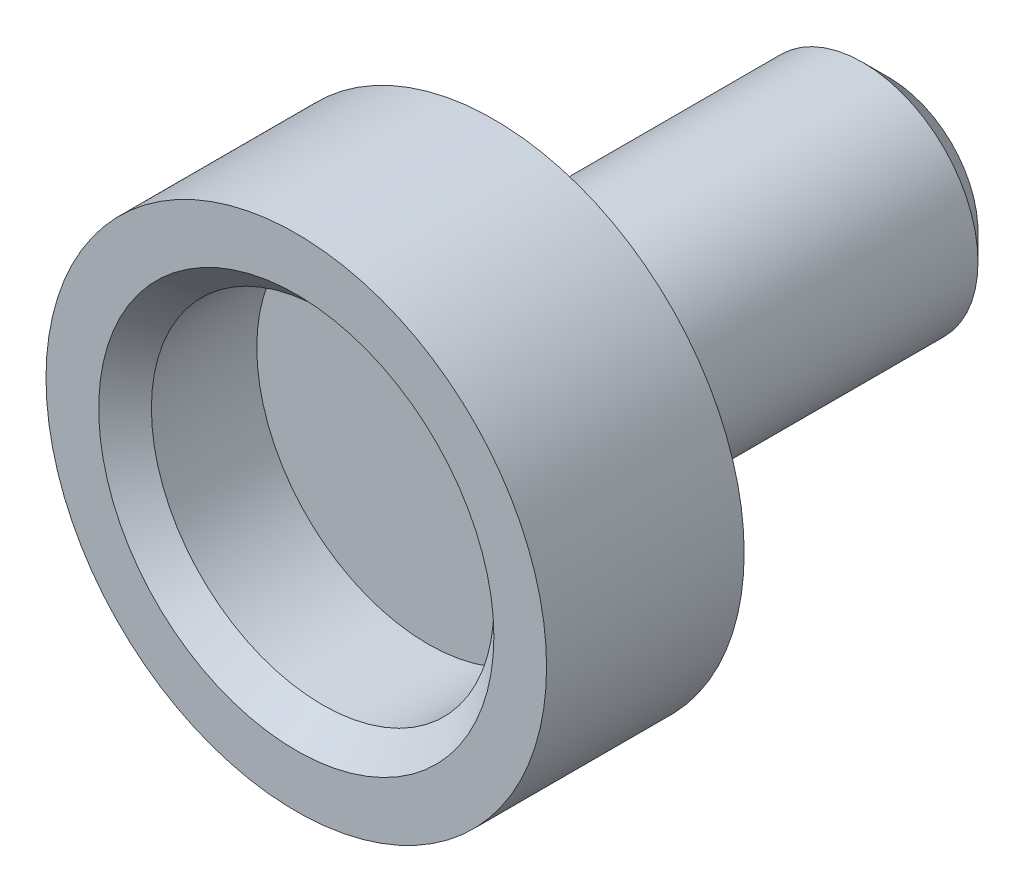
from build123d import *

# Parameters (mm, degrees)
ESQUISSE1_R        = 3.8
ESQUISSE1_R_2      = 2.6
BOSS_EXTRU_1_DEPTH = 2
BOSS_EXTRU_2_START = 1
ESQUISSE2_R        = 3.8
BOSS_EXTRU_2_DEPTH = 1
ESQUISSE3_R        = 1.75
BOSS_EXTRU_3_DEPTH = 6
CONG_1_R           = 0.6
CHANFREIN1_SIZE    = 0.4
CHANFREIN2_SIZE    = 0.4


with BuildPart() as part:
    # Esquisse1 → Boss.-Extru.1 (new body)
    with BuildSketch(Plane.XY):
        Circle(ESQUISSE1_R)
        Circle(ESQUISSE1_R_2, mode=Mode.SUBTRACT)
    extrude(amount=BOSS_EXTRU_1_DEPTH)

    # Esquisse2 → Boss.-Extru.2 (add)
    with BuildSketch(Plane(origin=(0, 0, 0), x_dir=(-1, 0, 0), z_dir=(0, 0, -1)).offset(BOSS_EXTRU_2_START)):
        Circle(ESQUISSE2_R)
    extrude(amount=-BOSS_EXTRU_2_DEPTH)

    # Esquisse3 → Boss.-Extru.3 (add)
    with BuildSketch(Plane(origin=(0, 0, -1), x_dir=(-1, 0, 0), z_dir=(0, 0, -1))):
        Circle(ESQUISSE3_R)
    extrude(amount=BOSS_EXTRU_3_DEPTH)

    # Congé1
    cong_1_edges = [part.edges().sort_by_distance(p)[0] for p in [
        (1.75, 0, -1),
    ]]
    fillet(cong_1_edges, radius=CONG_1_R)

    # Chanfrein1
    chanfrein1_edges = [part.edges().sort_by_distance(p)[0] for p in [
        (1.75, 0, -7),
    ]]
    chamfer(chanfrein1_edges, length=CHANFREIN1_SIZE)

    # Chanfrein2
    chanfrein2_edges = [part.edges().sort_by_distance(p)[0] for p in [
        (-2.6, 0, 2),
    ]]
    chamfer(chanfrein2_edges, length=CHANFREIN2_SIZE)


solid = part.part
